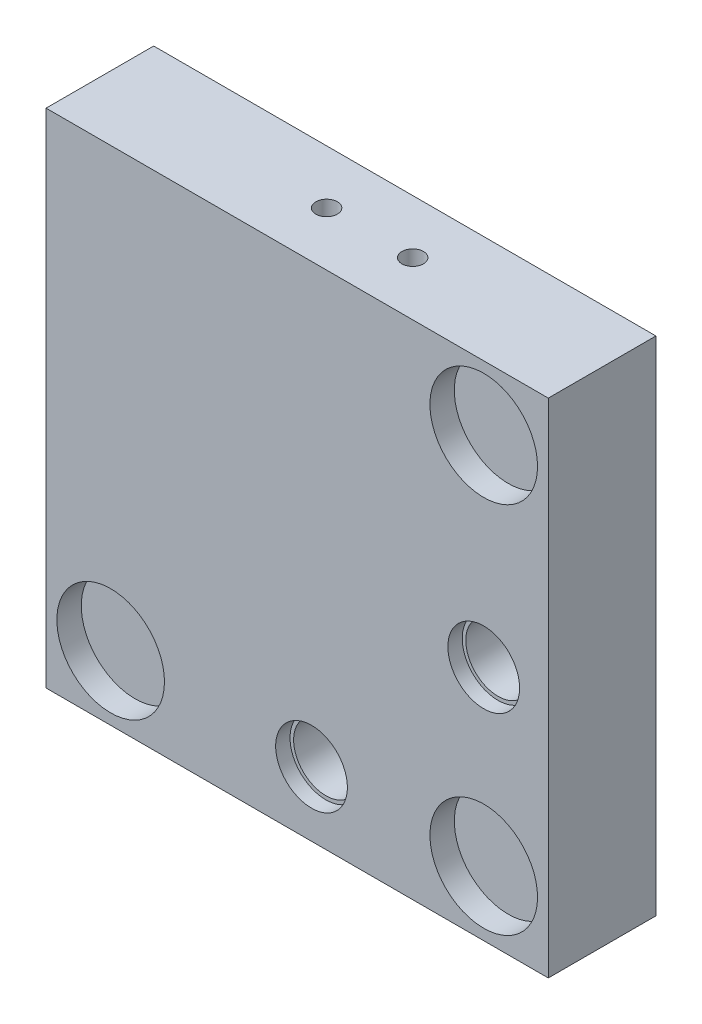
from build123d import *

# Parameters (mm, degrees)
SKETCH1_W           = 35
SKETCH1_H           = 35
BOSS_EXTRUDE1_DEPTH = 7.5
SKETCH2_W           = 24
SKETCH2_H           = 13
CUT_EXTRUDE2_DEPTH  = 4
SKETCH4_R           = 3.75
CUT_EXTRUDE3_DEPTH  = 1.7
SKETCH10_R          = 0.75
CUT_EXTRUDE7_DEPTH  = 7
SKETCH5_R           = 2.5
CUT_EXTRUDE11_DEPTH = 1
SKETCH11_R          = 2.25
CUT_EXTRUDE12_DEPTH = 5


with BuildPart() as part:
    # Sketch1 → Boss-Extrude1 (new body)
    with BuildSketch(Plane.XY):
        with Locations((-0.233740073, -3.509910016)):
            Rectangle(SKETCH1_W, SKETCH1_H)
    extrude(amount=BOSS_EXTRUDE1_DEPTH)

    # Sketch2 → Cut-Extrude2 (cut)
    with BuildSketch(Plane(origin=(0, 0, 0), x_dir=(-1, 0, 0), z_dir=(0, 0, -1))):
        with Locations((5.733740073, -3.509910016)):
            Rectangle(SKETCH2_W, SKETCH2_H)
    extrude(amount=-CUT_EXTRUDE2_DEPTH, mode=Mode.SUBTRACT)

    # Sketch4 → Cut-Extrude3 (cut)
    with BuildSketch(Plane.XY.offset(7.5)):
        with Locations((12.766259927, -16.509910016)):
            Circle(SKETCH4_R)
        with Locations((-13.233740073, -16.509910016)):
            Circle(SKETCH4_R)
        with Locations((12.766259927, 9.490089984)):
            Circle(SKETCH4_R)
    extrude(amount=-CUT_EXTRUDE3_DEPTH, mode=Mode.SUBTRACT)

    # Sketch10 → Cut-Extrude7 (cut)
    with BuildSketch(Plane(origin=(0, 13.990089984, 0), x_dir=(1, 0, 0), z_dir=(0, 1, 0))):
        with Locations((4.066259927, -3.75)):
            Circle(SKETCH10_R)
        with Locations((-1.933740073, -3.75)):
            Circle(SKETCH10_R)
    extrude(amount=-CUT_EXTRUDE7_DEPTH, mode=Mode.SUBTRACT)

    # Sketch5 → Cut-Extrude11 (cut)
    with BuildSketch(Plane.XY.offset(7.5)):
        with Locations((12.766259927, -4.509910016)):
            Circle(SKETCH5_R)
        with Locations((0.766259927, -16.509910016)):
            Circle(SKETCH5_R)
    extrude(amount=-CUT_EXTRUDE11_DEPTH, mode=Mode.SUBTRACT)

    # Sketch11 → Cut-Extrude12 (cut)
    with BuildSketch(Plane.XY.offset(6.5)):
        with Locations((0.766259927, -16.509910016)):
            Circle(SKETCH11_R)
        with Locations((12.766259927, -4.509910016)):
            Circle(SKETCH11_R)
    extrude(amount=-CUT_EXTRUDE12_DEPTH, mode=Mode.SUBTRACT)


solid = part.part
